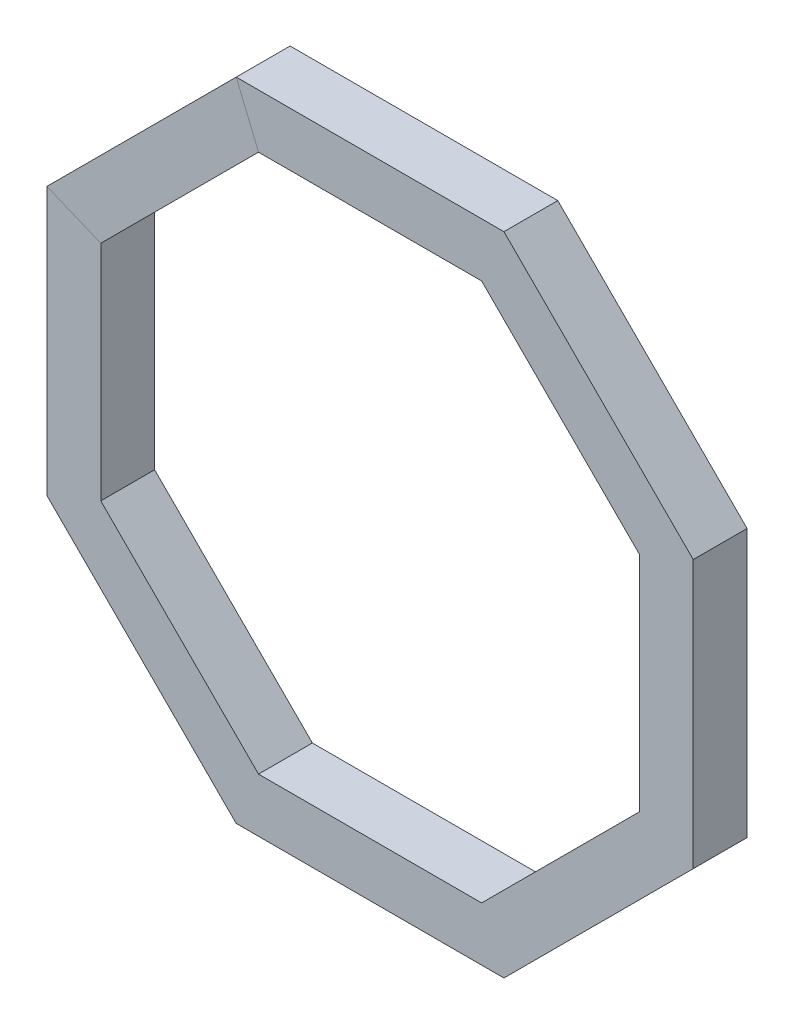
from build123d import *

# Parameters (mm, degrees)
RESSALTO_EXTRUS_O1_DEPTH   = 30
RESSALTO_EXTRUS_O1_2_DEPTH = 30
RESSALTO_EXTRUS_O2_DEPTH   = 2
RESSALTO_EXTRUS_O3_START   = 30
RESSALTO_EXTRUS_O3_DEPTH   = 2
DIVIDIR1_DEPTH             = 30
DIVIDIR1_2_DEPTH           = 30
DIVIDIR1_3_DEPTH           = 2
DIVIDIR1_START             = 28
DIVIDIR1_4_DEPTH           = 2


# Read off the part's stored shape, not the designer's step: Dividir1
with BuildPart() as part:
    # Esboço2 → Ressalto-extrusão1 (new body)
    with BuildSketch(Plane.XY):
        Polygon((74.558441227, -180), (180, -74.558441227), (180, 74.558441227), (74.558441227, 180), (-74.558441227, 180), (-180, 74.558441227), (-180, -74.558441227), (-74.558441227, -180), align=None)
        Polygon((178, -73.730014102), (178, 73.730014102), (73.730014102, 178), (-73.730014102, 178), (-178, 73.730014102), (-178, -73.730014102), (-73.730014102, -178), (73.730014102, -178), align=None, mode=Mode.SUBTRACT)
    extrude(amount=RESSALTO_EXTRUS_O1_DEPTH)



with BuildPart() as body_2:
    # Esboço2 → Ressalto-extrus_o1 2 (new body)
    with BuildSketch(Plane.XY):
        Polygon((62.960461481, -152), (152, -62.960461481), (152, 62.960461481), (62.960461481, 152), (-62.960461481, 152), (-152, 62.960461481), (-152, -62.960461481), (-62.960461481, -152), align=None)
        Polygon((150, -62.132034356), (150, 62.132034356), (62.132034356, 150), (-62.132034356, 150), (-150, 62.132034356), (-150, -62.132034356), (-62.132034356, -150), (62.132034356, -150), align=None, mode=Mode.SUBTRACT)
    extrude(amount=RESSALTO_EXTRUS_O1_2_DEPTH)


with BuildPart() as part_1:
    add(part.part)

    add(body_2.part)  # Ressalto-extrusão2 merges body 2
    # Esboço2<4> → Ressalto-extrusão2 (add)
    with BuildSketch(Plane.XY):
        Polygon((73.730014102, -178), (178, -73.730014102), (178, 73.730014102), (73.730014102, 178), (-73.730014102, 178), (-178, 73.730014102), (-178, -73.730014102), (-73.730014102, -178), align=None)
        Polygon((152, -62.960461481), (152, 62.960461481), (62.960461481, 152), (-62.960461481, 152), (-152, 62.960461481), (-152, -62.960461481), (-62.960461481, -152), (62.960461481, -152), align=None, mode=Mode.SUBTRACT)
    extrude(amount=RESSALTO_EXTRUS_O2_DEPTH)

    # Esboço2<7> → Ressalto-extrusão3 (add)
    with BuildSketch(Plane.XY.offset(RESSALTO_EXTRUS_O3_START)):
        Polygon((73.730014102, -178), (178, -73.730014102), (178, 73.730014102), (73.730014102, 178), (-73.730014102, 178), (-178, 73.730014102), (-178, -73.730014102), (-73.730014102, -178), align=None)
        Polygon((152, -62.960461481), (152, 62.960461481), (62.960461481, 152), (-62.960461481, 152), (-152, 62.960461481), (-152, -62.960461481), (-62.960461481, -152), (62.960461481, -152), align=None, mode=Mode.SUBTRACT)
    extrude(amount=-RESSALTO_EXTRUS_O3_DEPTH)

    # Dividir1 outline → Dividir1 (cut)
    with BuildSketch(Plane.XY):
        Polygon((-150, 62.132034356), (-62.132034356, 150), (-74.558441227, 180), (-180, 74.558441227), align=None)
    extrude(amount=DIVIDIR1_DEPTH, mode=Mode.SUBTRACT)


with BuildPart() as body_2_2:
    # Dividir1 2 outline → Dividir1 2 (new body)
    with BuildSketch(Plane.XY):
        Polygon((-152, 62.960461481), (-150, 62.132034356), (-62.132034356, 150), (-62.960461481, 152), align=None)
        Polygon((-180, 74.558441227), (-178, 73.730014102), (-73.730014102, 178), (-74.558441227, 180), align=None)
    extrude(amount=DIVIDIR1_2_DEPTH)

    # Dividir1 3 outline → Dividir1 3 (add)
    with BuildSketch(Plane.XY):
        Polygon((-178, 73.730014102), (-152, 62.960461481), (-62.960461481, 152), (-73.730014102, 178), align=None)
    extrude(amount=DIVIDIR1_3_DEPTH)

    # Dividir1 4 outline → Dividir1 4 (add)
    with BuildSketch(Plane.XY.offset(DIVIDIR1_START)):
        Polygon((-178, 73.730014102), (-152, 62.960461481), (-62.960461481, 152), (-73.730014102, 178), align=None)
    extrude(amount=DIVIDIR1_4_DEPTH)


solid = Compound([part_1.part, body_2_2.part])
